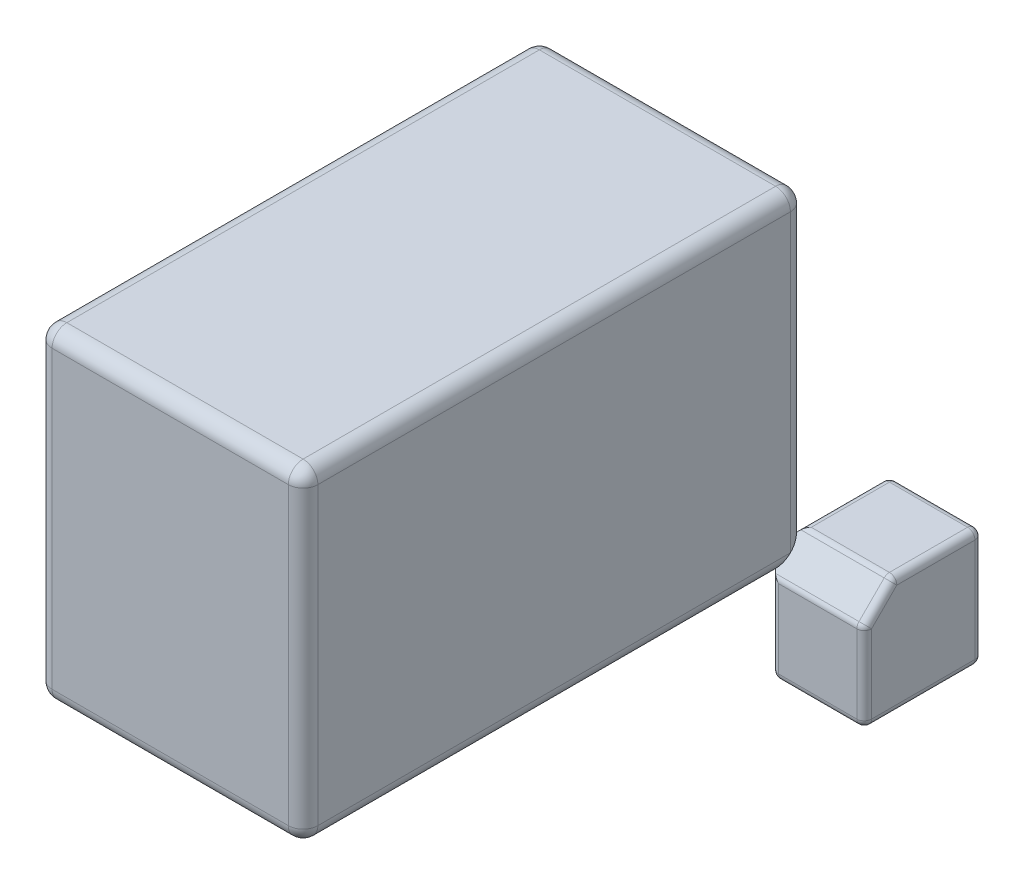
from build123d import *

# Parameters (mm, degrees)
SKETCH1_W                = 18
SKETCH1_H                = 22
BOSS_EXTRUDE1_DEPTH      = 34
SHELL1_T                 = 1
BOSS_EXTRUDE3_DEPTH      = 6
BOSS_EXTRUDE3_DEPTH_BACK = 2
SKETCH2_W                = 8
SKETCH2_H                = 8
CHAMFER2_SIZE            = 2
FILLET1_R                = 1
FILLET2_R                = 0.5


with BuildPart() as part:
    # Sketch1 → Boss-Extrude1 (new body)
    with BuildSketch(Plane.XY):
        with Locations((9, 11)):
            Rectangle(SKETCH1_W, SKETCH1_H)
    extrude(amount=BOSS_EXTRUDE1_DEPTH)

    # Shell1 (no face opened: a closed hollow body)
    add(offset(amount=-SHELL1_T, mode=Mode.PRIVATE), mode=Mode.SUBTRACT)

    # Sketch2 → Boss-Extrude3 (add, two sides: drawn at the far end of the back side and taken through both)
    with BuildSketch(Plane(origin=(0, 0, 0), x_dir=(-1, 0, 0), z_dir=(0, 0, -1)).offset(-BOSS_EXTRUDE3_DEPTH_BACK)):
        with Locations((-20, -2)):
            Rectangle(SKETCH2_W, SKETCH2_H)
    extrude(amount=BOSS_EXTRUDE3_DEPTH + BOSS_EXTRUDE3_DEPTH_BACK)

    # Chamfer2
    chamfer2_edges = [part.edges().sort_by_distance(p)[0] for p in [
        (16, -3, 2),
        (16, 2, -3),
        (21, 2, 2),
    ]]
    chamfer(chamfer2_edges, length=CHAMFER2_SIZE)

    # Fillet1
    # the kernel refuses this fillet: 1 mm, written as the material it takes off along each edge
    with BuildSketch(Plane(origin=(1, 21, 1), x_dir=(0, 1, 0), z_dir=(0, 0, -1))) as fillet1_piece_1_section:
        Polygon((0, 0), (FILLET1_R, 0), (FILLET1_R, -FILLET1_R), (0, -FILLET1_R), align=None)
    fillet1_piece_1 = extrude(amount=FILLET1_R, mode=Mode.PRIVATE)
    fillet1_piece_1 = fillet1_piece_1 - Plane(origin=(1, 21, 1), x_dir=(0.7071067811865476, -0.7071067811865475, 0), z_dir=(0, 0, -1)) * Sphere(FILLET1_R, mode=Mode.PRIVATE)
    add(fillet1_piece_1, mode=Mode.SUBTRACT)
    with BuildSketch(Plane(origin=(1, 1, 1), x_dir=(0, 0, -1), z_dir=(0, -1, 0))) as fillet1_piece_2_section:
        Polygon((0, 0), (FILLET1_R, 0), (FILLET1_R, -FILLET1_R), (0, -FILLET1_R), align=None)
    fillet1_piece_2 = extrude(amount=FILLET1_R, mode=Mode.PRIVATE)
    fillet1_piece_2 = fillet1_piece_2 - Plane(origin=(1, 1, 1), x_dir=(0.7071067811865475, 0, 0.7071067811865475), z_dir=(0, -1, 0)) * Sphere(FILLET1_R, mode=Mode.PRIVATE)
    add(fillet1_piece_2, mode=Mode.SUBTRACT)
    with BuildSketch(Plane(origin=(17, 21, 1), x_dir=(0, 0, -1), z_dir=(0, 1, 0))) as fillet1_piece_3_section:
        Polygon((0, 0), (FILLET1_R, 0), (FILLET1_R, -FILLET1_R), (0, -FILLET1_R), align=None)
    fillet1_piece_3 = extrude(amount=FILLET1_R, mode=Mode.PRIVATE)
    fillet1_piece_3 = fillet1_piece_3 - Plane(origin=(17, 21, 1), x_dir=(-0.7071067811865475, 0, 0.7071067811865475), z_dir=(0, 1, 0)) * Sphere(FILLET1_R, mode=Mode.PRIVATE)
    add(fillet1_piece_3, mode=Mode.SUBTRACT)
    with BuildSketch(Plane(origin=(1, 1, 33), x_dir=(-1, 0, 0), z_dir=(0, -1, 0))) as fillet1_piece_4_section:
        Polygon((0, 0), (FILLET1_R, 0), (FILLET1_R, -FILLET1_R), (0, -FILLET1_R), align=None)
    fillet1_piece_4 = extrude(amount=FILLET1_R, mode=Mode.PRIVATE)
    fillet1_piece_4 = fillet1_piece_4 - Plane(origin=(1, 1, 33), x_dir=(0.7071067811865475, 0, -0.7071067811865475), z_dir=(0, -1, 0)) * Sphere(FILLET1_R, mode=Mode.PRIVATE)
    add(fillet1_piece_4, mode=Mode.SUBTRACT)
    with BuildSketch(Plane(origin=(17, 1, 33), x_dir=(1, 0, 0), z_dir=(0, -1, 0))) as fillet1_piece_5_section:
        Polygon((0, 0), (FILLET1_R, 0), (FILLET1_R, FILLET1_R), (0, FILLET1_R), align=None)
    fillet1_piece_5 = extrude(amount=FILLET1_R, mode=Mode.PRIVATE)
    fillet1_piece_5 = fillet1_piece_5 - Plane(origin=(17, 1, 33), x_dir=(-0.7071067811865475, 0, -0.7071067811865475), z_dir=(0, -1, 0)) * Sphere(FILLET1_R, mode=Mode.PRIVATE)
    add(fillet1_piece_5, mode=Mode.SUBTRACT)
    with BuildSketch(Plane(origin=(17, 21, 33), x_dir=(1, 0, 0), z_dir=(0, 1, 0))) as fillet1_piece_6_section:
        Polygon((0, 0), (FILLET1_R, 0), (FILLET1_R, -FILLET1_R), (0, -FILLET1_R), align=None)
    fillet1_piece_6 = extrude(amount=FILLET1_R, mode=Mode.PRIVATE)
    fillet1_piece_6 = fillet1_piece_6 - Plane(origin=(17, 21, 33), x_dir=(-0.7071067811865475, 0, -0.7071067811865475), z_dir=(0, 1, 0)) * Sphere(FILLET1_R, mode=Mode.PRIVATE)
    add(fillet1_piece_6, mode=Mode.SUBTRACT)
    with BuildSketch(Plane(origin=(1, 21, 33), x_dir=(-1, 0, 0), z_dir=(0, 1, 0))) as fillet1_piece_7_section:
        Polygon((0, 0), (FILLET1_R, 0), (FILLET1_R, FILLET1_R), (0, FILLET1_R), align=None)
    fillet1_piece_7 = extrude(amount=FILLET1_R, mode=Mode.PRIVATE)
    fillet1_piece_7 = fillet1_piece_7 - Plane(origin=(1, 21, 33), x_dir=(0.7071067811865475, 0, -0.7071067811865475), z_dir=(0, 1, 0)) * Sphere(FILLET1_R, mode=Mode.PRIVATE)
    add(fillet1_piece_7, mode=Mode.SUBTRACT)
    with BuildSketch(Plane(origin=(0, 21, 0), x_dir=(1, 0, 0), z_dir=(0, -1, 0)), Plane(origin=(18, 1, 34), x_dir=(0, 0, -1), z_dir=(0, 1, 0)), Plane(origin=(0, 21, 34), x_dir=(0, 0, -1), z_dir=(0, -1, 0))) as fillet1_piece_8:
        with BuildLine():
            CenterArc((FILLET1_R, FILLET1_R), FILLET1_R, 180, 90)
            Line((0, FILLET1_R), (0, 0))
            Line((0, 0), (FILLET1_R, 0))
        make_face()
    extrude(amount=20, mode=Mode.SUBTRACT)
    with BuildSketch(Plane(origin=(1, 0, 0), x_dir=(0, 0, 1), z_dir=(1, 0, 0))) as fillet1_piece_9_section:
        with BuildLine():
            CenterArc((FILLET1_R, -FILLET1_R), FILLET1_R, 90, 90)
            Line((0, -FILLET1_R), (0, 0))
            Line((0, 0), (FILLET1_R, 0))
        make_face()
    fillet1_piece_9 = extrude(amount=17.5, mode=Mode.PRIVATE)
    fillet1_piece_9 = split(fillet1_piece_9, bisect_by=Plane(origin=(12.381861728, 0.226424858, -3.618138272), z_dir=(-0.7071067811865476, 0, 0.7071067811865476)), keep=Keep.TOP, mode=Mode.PRIVATE)
    fillet1_piece_9 = split(fillet1_piece_9, bisect_by=Plane(origin=(12.381861728, -3.618138272, 0.226424858), z_dir=(-0.7071067811865476, 0.7071067811865476, 0)), keep=Keep.TOP, mode=Mode.PRIVATE)
    add(fillet1_piece_9, mode=Mode.SUBTRACT)
    with BuildSketch(Plane(origin=(1, 0, 0), x_dir=(0, 0, 1), z_dir=(1, 0, 0))) as fillet1_piece_10_section:
        with BuildLine():
            CenterArc((FILLET1_R, -FILLET1_R), FILLET1_R, 90, 90)
            Line((0, -FILLET1_R), (0, 0))
            Line((0, 0), (FILLET1_R, 0))
        make_face()
    fillet1_piece_10 = extrude(amount=17.5, mode=Mode.PRIVATE)
    fillet1_piece_10 = split(fillet1_piece_10, bisect_by=Plane(origin=(16.16446835, 0.528927527, 0.16446835), z_dir=(0.7071067811865476, 0, -0.7071067811865476)), keep=Keep.TOP, mode=Mode.PRIVATE)
    fillet1_piece_10 = split(fillet1_piece_10, bisect_by=Plane(origin=(16.407441135, 0.407441135, 0.042981958), z_dir=(-0.7071067811865476, 0.7071067811865476, 0)), keep=Keep.TOP, mode=Mode.PRIVATE)
    add(fillet1_piece_10, mode=Mode.SUBTRACT)
    with BuildSketch(Plane(origin=(1, 0, 0), x_dir=(0, 0, 1), z_dir=(1, 0, 0))) as fillet1_piece_11_section:
        with BuildLine():
            CenterArc((FILLET1_R, -FILLET1_R), FILLET1_R, 90, 90)
            Line((0, -FILLET1_R), (0, 0))
            Line((0, 0), (FILLET1_R, 0))
        make_face()
    fillet1_piece_11 = extrude(amount=17.5, mode=Mode.PRIVATE)
    fillet1_piece_11 = split(fillet1_piece_11, bisect_by=Plane(origin=(16.407441135, 0.042981958, 0.407441135), z_dir=(-0.7071067811865476, 0, 0.7071067811865476)), keep=Keep.TOP, mode=Mode.PRIVATE)
    fillet1_piece_11 = split(fillet1_piece_11, bisect_by=Plane(origin=(16.16446835, 0.16446835, 0.528927527), z_dir=(0.7071067811865476, -0.7071067811865476, 0)), keep=Keep.TOP, mode=Mode.PRIVATE)
    add(fillet1_piece_11, mode=Mode.SUBTRACT)
    with BuildSketch(Plane(origin=(18, -0.5, 0), x_dir=(-1, 0, 0), z_dir=(0, 1, 0))) as fillet1_piece_12_section:
        with BuildLine():
            CenterArc((FILLET1_R, FILLET1_R), FILLET1_R, 180, 90)
            Line((0, FILLET1_R), (0, 0))
            Line((0, 0), (FILLET1_R, 0))
        make_face()
    fillet1_piece_12 = extrude(amount=21.5, mode=Mode.PRIVATE)
    fillet1_piece_12 = split(fillet1_piece_12, bisect_by=Plane(origin=(17.83553165, 1.83553165, 0.528927527), z_dir=(0.7071067811865476, -0.7071067811865476, 0)), keep=Keep.TOP, mode=Mode.PRIVATE)
    fillet1_piece_12 = split(fillet1_piece_12, bisect_by=Plane(origin=(17.957018042, 1.592558865, 0.407441135), z_dir=(0, 0.7071067811865476, 0.7071067811865476)), keep=Keep.TOP, mode=Mode.PRIVATE)
    add(fillet1_piece_12, mode=Mode.SUBTRACT)
    with BuildSketch(Plane(origin=(18, -0.5, 0), x_dir=(-1, 0, 0), z_dir=(0, 1, 0))) as fillet1_piece_13_section:
        with BuildLine():
            CenterArc((FILLET1_R, FILLET1_R), FILLET1_R, 180, 90)
            Line((0, FILLET1_R), (0, 0))
            Line((0, 0), (FILLET1_R, 0))
        make_face()
    fillet1_piece_13 = extrude(amount=21.5, mode=Mode.PRIVATE)
    fillet1_piece_13 = split(fillet1_piece_13, bisect_by=Plane(origin=(17.592558865, 1.592558865, 0.042981958), z_dir=(-0.7071067811865476, 0.7071067811865476, 0)), keep=Keep.TOP, mode=Mode.PRIVATE)
    fillet1_piece_13 = split(fillet1_piece_13, bisect_by=Plane(origin=(17.471072473, 1.83553165, 0.16446835), z_dir=(0, -0.7071067811865476, -0.7071067811865476)), keep=Keep.TOP, mode=Mode.PRIVATE)
    add(fillet1_piece_13, mode=Mode.SUBTRACT)
    with BuildSketch(Plane(origin=(18, -0.5, 0), x_dir=(-1, 0, 0), z_dir=(0, 1, 0))) as fillet1_piece_14_section:
        with BuildLine():
            CenterArc((FILLET1_R, FILLET1_R), FILLET1_R, 180, 90)
            Line((0, FILLET1_R), (0, 0))
            Line((0, 0), (FILLET1_R, 0))
        make_face()
    fillet1_piece_14 = extrude(amount=21.5, mode=Mode.PRIVATE)
    fillet1_piece_14 = split(fillet1_piece_14, bisect_by=Plane(origin=(22.618159496, 6.618159496, 0.226418621), z_dir=(-0.7071067811865476, 0.7071067811865476, 0)), keep=Keep.TOP, mode=Mode.PRIVATE)
    fillet1_piece_14 = split(fillet1_piece_14, bisect_by=Plane(origin=(17.773581379, 6.618159496, -4.618159496), z_dir=(0, 0.7071067811865476, 0.7071067811865476)), keep=Keep.TOP, mode=Mode.PRIVATE)
    add(fillet1_piece_14, mode=Mode.SUBTRACT)
    with BuildSketch(Plane(origin=(17, 22, 0), x_dir=(0, -1, 0), z_dir=(-1, 0, 0)), Plane(origin=(1, 0, 34), x_dir=(0, 0, -1), z_dir=(1, 0, 0))) as fillet1_piece_15:
        with BuildLine():
            CenterArc((FILLET1_R, FILLET1_R), FILLET1_R, 180, 90)
            Line((0, FILLET1_R), (0, 0))
            Line((0, 0), (FILLET1_R, 0))
        make_face()
    extrude(amount=16, mode=Mode.SUBTRACT)
    with BuildSketch(Plane(origin=(17, 22, 34), x_dir=(0, -1, 0), z_dir=(-1, 0, 0))) as fillet1_piece_16:
        with BuildLine():
            CenterArc((FILLET1_R, -FILLET1_R), FILLET1_R, 90, 90)
            Line((0, -FILLET1_R), (0, 0))
            Line((0, 0), (FILLET1_R, 0))
        make_face()
    extrude(amount=16, mode=Mode.SUBTRACT)
    with BuildSketch(Plane(origin=(0, 22, 1), x_dir=(0, -1, 0), z_dir=(0, 0, 1)), Plane(origin=(0, 0, 1), x_dir=(1, 0, 0), z_dir=(0, 0, 1))) as fillet1_piece_17:
        with BuildLine():
            CenterArc((FILLET1_R, FILLET1_R), FILLET1_R, 180, 90)
            Line((0, FILLET1_R), (0, 0))
            Line((0, 0), (FILLET1_R, 0))
        make_face()
    extrude(amount=32, mode=Mode.SUBTRACT)
    with BuildSketch(Plane(origin=(18, 22, 1), x_dir=(0, -1, 0), z_dir=(0, 0, 1))) as fillet1_piece_18:
        with BuildLine():
            CenterArc((FILLET1_R, -FILLET1_R), FILLET1_R, 90, 90)
            Line((0, -FILLET1_R), (0, 0))
            Line((0, 0), (FILLET1_R, 0))
        make_face()
    extrude(amount=32, mode=Mode.SUBTRACT)
    with BuildSketch(Plane(origin=(18, 0, -0.5), x_dir=(-1, 0, 0), z_dir=(0, 0, 1))) as fillet1_piece_19_section:
        with BuildLine():
            CenterArc((FILLET1_R, -FILLET1_R), FILLET1_R, 90, 90)
            Line((0, -FILLET1_R), (0, 0))
            Line((0, 0), (FILLET1_R, 0))
        make_face()
    fillet1_piece_19 = extrude(amount=33.5, mode=Mode.PRIVATE)
    fillet1_piece_19 = split(fillet1_piece_19, bisect_by=Plane(origin=(17.83553165, 0.528927527, 1.83553165), z_dir=(0.7071067811865476, 0, -0.7071067811865476)), keep=Keep.TOP, mode=Mode.PRIVATE)
    fillet1_piece_19 = split(fillet1_piece_19, bisect_by=Plane(origin=(17.957018042, 0.407441135, 1.592558865), z_dir=(0, 0.7071067811865476, 0.7071067811865476)), keep=Keep.TOP, mode=Mode.PRIVATE)
    add(fillet1_piece_19, mode=Mode.SUBTRACT)
    with BuildSketch(Plane(origin=(18, 0, -0.5), x_dir=(-1, 0, 0), z_dir=(0, 0, 1))) as fillet1_piece_20_section:
        with BuildLine():
            CenterArc((FILLET1_R, -FILLET1_R), FILLET1_R, 90, 90)
            Line((0, -FILLET1_R), (0, 0))
            Line((0, 0), (FILLET1_R, 0))
        make_face()
    fillet1_piece_20 = extrude(amount=33.5, mode=Mode.PRIVATE)
    fillet1_piece_20 = split(fillet1_piece_20, bisect_by=Plane(origin=(17.592558865, 0.042981958, 1.592558865), z_dir=(-0.7071067811865476, 0, 0.7071067811865476)), keep=Keep.TOP, mode=Mode.PRIVATE)
    fillet1_piece_20 = split(fillet1_piece_20, bisect_by=Plane(origin=(17.471072473, 0.16446835, 1.83553165), z_dir=(0, -0.7071067811865476, -0.7071067811865476)), keep=Keep.TOP, mode=Mode.PRIVATE)
    add(fillet1_piece_20, mode=Mode.SUBTRACT)
    with BuildSketch(Plane(origin=(18, 0, -0.5), x_dir=(-1, 0, 0), z_dir=(0, 0, 1))) as fillet1_piece_21_section:
        with BuildLine():
            CenterArc((FILLET1_R, -FILLET1_R), FILLET1_R, 90, 90)
            Line((0, -FILLET1_R), (0, 0))
            Line((0, 0), (FILLET1_R, 0))
        make_face()
    fillet1_piece_21 = extrude(amount=33.5, mode=Mode.PRIVATE)
    fillet1_piece_21 = split(fillet1_piece_21, bisect_by=Plane(origin=(25.618190384, 0.226409543, 9.618190384), z_dir=(-0.7071067811865476, 0, 0.7071067811865476)), keep=Keep.TOP, mode=Mode.PRIVATE)
    fillet1_piece_21 = split(fillet1_piece_21, bisect_by=Plane(origin=(17.773590457, -7.618190384, 9.618190384), z_dir=(0, 0.7071067811865476, 0.7071067811865476)), keep=Keep.TOP, mode=Mode.PRIVATE)
    add(fillet1_piece_21, mode=Mode.SUBTRACT)

    # Fillet2
    fillet2_edges = [part.edges().sort_by_distance(p)[0] for p in [
        (20, -6, -6),
        (24, -6, -2),
        (24, -2, -6),
        (24, 2, -3),
        (21, 2, -6),
        (18, 2, -3),
        (21, 2, 0),
        (24, -3, 2),
        (24, 1, 1),
        (21, -6, 2),
        (18, -3, 2),
        (21, 0, 2),
        (16, -3, -6),
        (16, -6, -3),
        (16, -3, 0),
        (16, 0, -3),
        (17, 1, -6),
        (17, -6, 1),
    ]]
    fillet(fillet2_edges, radius=FILLET2_R)


solid = part.part
